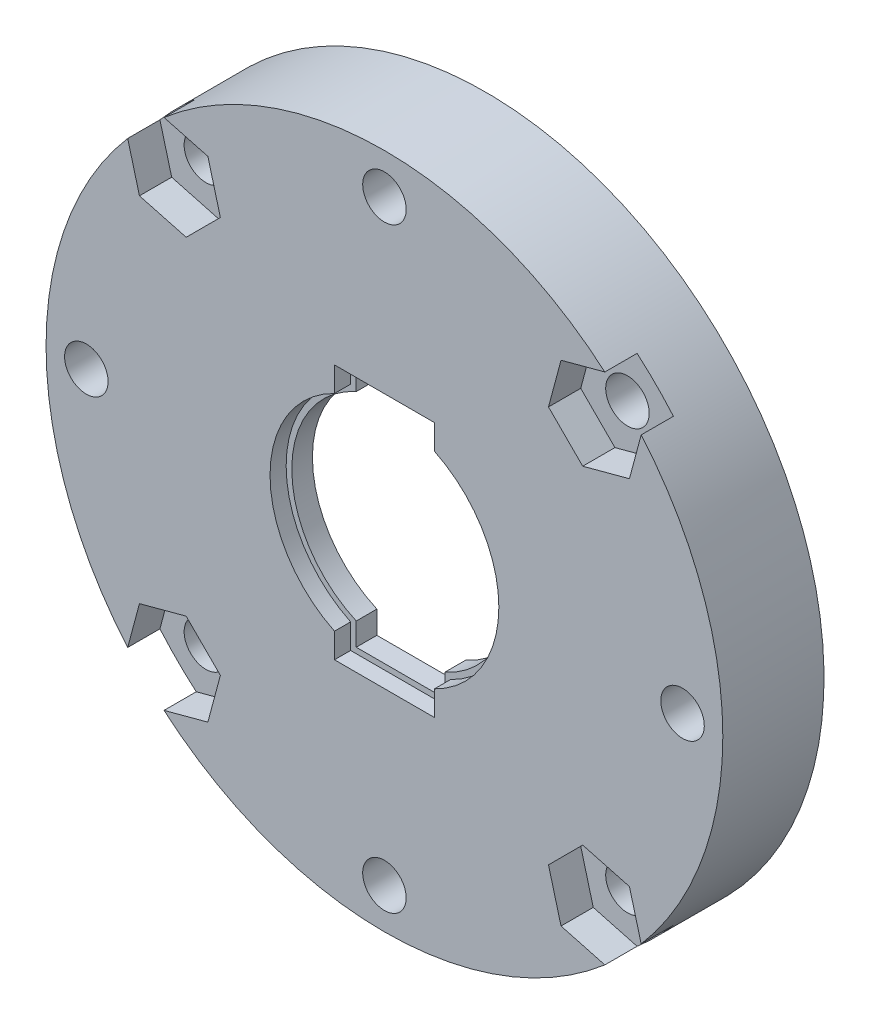
from build123d import *

# Parameters (mm, degrees)
SKETCH3_R           = 21
BOSS_EXTRUDE2_DEPTH = 1
SKETCH4_R           = 21
BOSS_EXTRUDE3_DEPTH = 5.28
SKETCH5_R           = 16.5
CUT_EXTRUDE1_DEPTH  = 4
CUT_EXTRUDE2_DEPTH  = 2
SKETCH8_R           = 1.35
CUT_EXTRUDE4_DEPTH  = 31.355203837
CIRPATTERN1_COUNT   = 4
CIRPATTERN2_COUNT   = 8


with BuildPart() as part:
    # Sketch3 → Boss-Extrude2 (new body)
    with BuildSketch(Plane.XY):
        Circle(SKETCH3_R)
        with BuildLine():
            Line((-3.099988, -6.387493593), (-3.099988, -7.924679))
            Line((-3.099988, -7.924679), (3.100012, -7.924679))
            Line((3.100012, -7.924679), (3.100012, -6.387481945))
            ThreePointArc((3.100012, -6.387481945), (7.1, 0), (3.100012, 6.387481945))
            Line((3.100012, 6.387481945), (3.100012, 7.924431))
            Line((3.100012, 7.924431), (-3.099988, 7.924431))
            Line((-3.099988, 7.924431), (-3.099988, 6.387493593))
            ThreePointArc((-3.099988, 6.387493593), (-7.1, 0), (-3.099988, -6.387493593))
        make_face(mode=Mode.SUBTRACT)
    extrude(amount=-BOSS_EXTRUDE2_DEPTH)

    # Sketch4 → Boss-Extrude3 (add)
    with BuildSketch(Plane(origin=(0, 0, -1), x_dir=(-1, 0, 0), z_dir=(0, 0, -1))):
        Circle(SKETCH4_R)
        with BuildLine():
            Line((2.749988, 6.164419356), (2.749988, 7.574431))
            Line((2.749988, 7.574431), (-2.750012, 7.574431))
            Line((-2.750012, 7.574431), (-2.750012, 6.16440865))
            ThreePointArc((-2.750012, 6.16440865), (-6.75, 0), (-2.750012, -6.16440865))
            Line((-2.750012, -6.16440865), (-2.750012, -7.574679))
            Line((-2.750012, -7.574679), (2.749988, -7.574679))
            Line((2.749988, -7.574679), (2.749988, -6.164419356))
            ThreePointArc((2.749988, -6.164419356), (6.75, 0), (2.749988, 6.164419356))
        make_face(mode=Mode.SUBTRACT)
    extrude(amount=BOSS_EXTRUDE3_DEPTH)

    # Sketch5 → Cut-Extrude1 (cut)
    with BuildSketch(Plane(origin=(0, 0, -6.28), x_dir=(-1, 0, 0), z_dir=(0, 0, -1))):
        Circle(SKETCH5_R)
    extrude(amount=-CUT_EXTRUDE1_DEPTH, mode=Mode.SUBTRACT)

    # Sketch6 → Cut-Extrude2 (cut)
    with BuildSketch(Plane.XY):
        Polygon((13.858507528, 15.981398638), (10.958584342, 15.204366562), (10.181552266, 12.304443376), (12.304443376, 10.181552266), (15.204366562, 10.958584342), (15.981398638, 13.858507528), align=None)
    cut_extrude2 = extrude(amount=-CUT_EXTRUDE2_DEPTH, mode=Mode.SUBTRACT)

    # Sketch8 → Cut-Extrude4 (cut, through all)
    with BuildSketch(Plane.XY):
        with Locations((13.081475452, 13.081475452)):
            Circle(SKETCH8_R)
    cut_extrude4 = extrude(amount=-CUT_EXTRUDE4_DEPTH, mode=Mode.SUBTRACT)

    # CirPattern1: Cut-Extrude2, Cut-Extrude4 ×4 about axis
    cirpattern1_axis = Axis((0, 0, -0.1), (0, 0, 1))
    add([cut_extrude2.rotate(cirpattern1_axis, i * 360 / CIRPATTERN1_COUNT) for i in range(1, CIRPATTERN1_COUNT)], mode=Mode.SUBTRACT)
    add([cut_extrude4.rotate(cirpattern1_axis, i * 360 / CIRPATTERN1_COUNT) for i in range(1, CIRPATTERN1_COUNT)], mode=Mode.SUBTRACT)

    # CirPattern2: Cut-Extrude4 ×8 about axis
    cirpattern2_axis = Axis((0, 0, -0.1), (0, 0, 1))
    for i in range(1, CIRPATTERN2_COUNT):
        add(cut_extrude4.rotate(cirpattern2_axis, i * 360 / CIRPATTERN2_COUNT), mode=Mode.SUBTRACT)


solid = part.part
